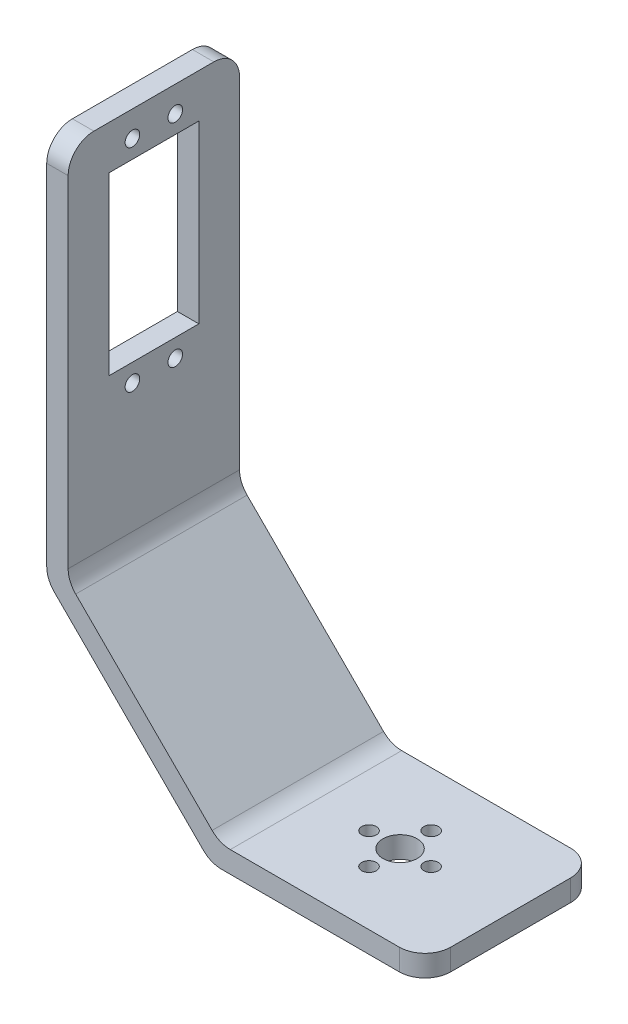
from build123d import *

# Parameters (mm, degrees)
EXTRUDE_1_DEPTH     = 40
FILLET_7_R          = 6
SKETCH_6_R          = 4
SKETCH_6_R_2        = 1.7
CUT_EXTRUDE_4_DEPTH = 40
SKETCH_7_R          = 1.7
SKETCH_7_W          = 21
SKETCH_7_H          = 41
CUT_EXTRUDE_5_DEPTH = 10
FILLET_8_R          = 6
FILLET_9_R          = 6
FILLET_10_R         = 6
FILLET_11_R         = 6
FILLET_12_R         = 6
FILLET_13_R         = 6
FILLET_14_R         = 6
EXTRUDE_2_DEPTH     = 10
SKETCH_9_W          = 14
SKETCH_9_H          = 4
CUT_EXTRUDE_6_DEPTH = 20
FILLET_15_R         = 2
FILLET_16_R         = 2
FILLET_17_R         = 2
FILLET_18_R         = 2


with BuildPart() as part:
    # 草图1 → 凸台-拉伸1 (new body)
    with BuildSketch(Plane.XY):
        Polygon((15.872975722, -72.274332462), (-32.055956466, -72.274332462), (-67.411295525, -36.918993403), (-67.411295525, 51.009938785), (-72.411295525, 51.009938785), (-72.411295525, -38.990061215), (-34.127024278, -77.274332462), (15.872975722, -77.274332462), align=None)
    extrude(amount=EXTRUDE_1_DEPTH)

    # 圆角7
    fillet_7_edges = [part.edges().sort_by_distance(p)[0] for p in [
        (-34.127024278, -77.274332462, 20),
    ]]
    fillet(fillet_7_edges, radius=FILLET_7_R)

    # 草图6 → 切除-拉伸4 (cut)
    with BuildSketch(Plane(origin=(0, -72.274332462, 0), x_dir=(1, 0, 0), z_dir=(0, 1, 0))):
        with Locations((-9.946126997, -20)):
            Circle(SKETCH_6_R)
        with Locations((-9.946126997, -12.75)):
            Circle(SKETCH_6_R_2)
        with Locations((-2.696126997, -20)):
            Circle(SKETCH_6_R_2)
        with Locations((-9.946126997, -27.25)):
            Circle(SKETCH_6_R_2)
        with Locations((-17.196126997, -20)):
            Circle(SKETCH_6_R_2)
    extrude(amount=-CUT_EXTRUDE_4_DEPTH, mode=Mode.SUBTRACT)

    # 草图7 → 切除-拉伸5 (cut)
    with BuildSketch(Plane(origin=(-67.411295525, -6.360766816, 0), x_dir=(0, 0, -1), z_dir=(-1, 0, 0))):
        with Locations((-25, -1.96100475)):
            Circle(SKETCH_7_R)
        with Locations((-15, -1.96100475)):
            Circle(SKETCH_7_R)
        with Locations((-25, -51.38100475)):
            Circle(SKETCH_7_R)
        with Locations((-15, -51.38100475)):
            Circle(SKETCH_7_R)
        with Locations((-20, -26.67100475)):
            Rectangle(SKETCH_7_W, SKETCH_7_H)
    extrude(amount=CUT_EXTRUDE_5_DEPTH, mode=Mode.SUBTRACT)

    # 圆角8
    fillet_8_edges = [part.edges().sort_by_distance(p)[0] for p in [
        (-32.055956466, -72.274332462, 20),
    ]]
    fillet(fillet_8_edges, radius=FILLET_8_R)

    # 圆角9
    fillet_9_edges = [part.edges().sort_by_distance(p)[0] for p in [
        (-72.411295525, -38.990061215, 20),
    ]]
    fillet(fillet_9_edges, radius=FILLET_9_R)

    # 圆角10
    fillet_10_edges = [part.edges().sort_by_distance(p)[0] for p in [
        (-67.411295525, -36.918993403, 20),
    ]]
    fillet(fillet_10_edges, radius=FILLET_10_R)

    # 圆角11
    fillet_11_edges = [part.edges().sort_by_distance(p)[0] for p in [
        (-69.911295525, 51.009938785, 0),
    ]]
    fillet(fillet_11_edges, radius=FILLET_11_R)

    # 圆角12
    fillet_12_edges = [part.edges().sort_by_distance(p)[0] for p in [
        (-69.911295525, 51.009938785, 40),
    ]]
    fillet(fillet_12_edges, radius=FILLET_12_R)

    # 圆角13
    fillet_13_edges = [part.edges().sort_by_distance(p)[0] for p in [
        (15.872975722, -74.774332462, 0),
    ]]
    fillet(fillet_13_edges, radius=FILLET_13_R)

    # 圆角14
    fillet_14_edges = [part.edges().sort_by_distance(p)[0] for p in [
        (15.872975722, -74.774332462, 40),
    ]]
    fillet(fillet_14_edges, radius=FILLET_14_R)

    # 草图8 → 凸台-拉伸2 (add, symmetric)
    with BuildSketch(Plane.XY.offset(20)):
        Polygon((-56.217665634, -55.183691106), (-49.853704603, -61.547652137), (-54.09634529, -65.790292824), (-60.460306321, -59.426331793), align=None)
    extrude(amount=EXTRUDE_2_DEPTH, both=True)

    # 草图9 → 切除-拉伸6 (cut)
    with BuildSketch(Plane(origin=(-0.516987264, 0.516987264, 0), x_dir=(0, 0, 1), z_dir=(-0.7071067811865477, 0.7071067811865475, 0))):
        with Locations((20, -80.772654784)):
            Rectangle(SKETCH_9_W, SKETCH_9_H)
    extrude(amount=-CUT_EXTRUDE_6_DEPTH, mode=Mode.SUBTRACT)

    # 圆角15
    fillet_15_edges = [part.edges().sort_by_distance(p)[0] for p in [
        (-57.278325806, -62.608312309, 10),
    ]]
    fillet(fillet_15_edges, radius=FILLET_15_R)

    # 圆角16
    fillet_16_edges = [part.edges().sort_by_distance(p)[0] for p in [
        (-57.278325806, -62.608312309, 30),
    ]]
    fillet(fillet_16_edges, radius=FILLET_16_R)

    # 圆角17
    fillet_17_edges = [part.edges().sort_by_distance(p)[0] for p in [
        (-55.864112243, -61.194098746, 13),
    ]]
    fillet(fillet_17_edges, radius=FILLET_17_R)

    # 圆角18
    fillet_18_edges = [part.edges().sort_by_distance(p)[0] for p in [
        (-55.864112243, -61.194098746, 27),
    ]]
    fillet(fillet_18_edges, radius=FILLET_18_R)


solid = part.part
